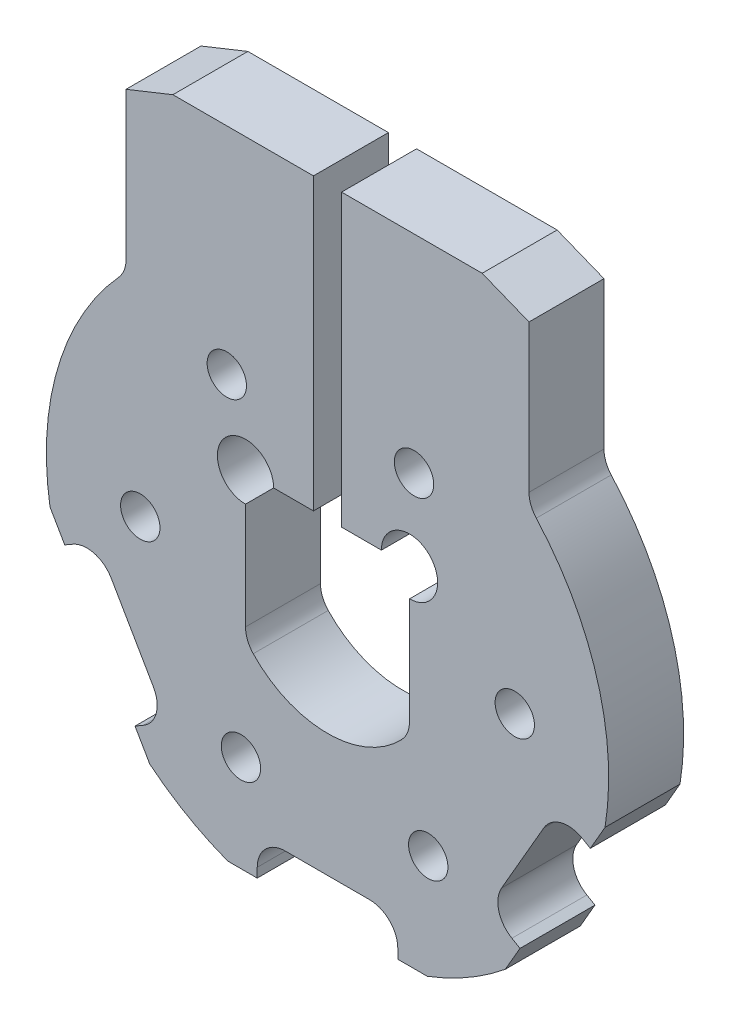
from build123d import *

# Parameters (mm, degrees)
SKIZZE1_R                       = 2.1
AUFSATZ_LINEAR_AUSTRAGEN1_DEPTH = 8


with BuildPart() as part:
    # Skizze1 → Aufsatz-Linear austragen1 (new body)
    with BuildSketch(Plane.XY):
        with BuildLine():
            Line((4.675877612, -29.316682076), (-4.324122388, -29.316682076))
            ThreePointArc((-4.324122388, -29.316682076), (-6.445442732, -30.195361732), (-7.324122388, -32.316682076))
            Line((-7.324122388, -32.316682076), (-7.324122388, -33.316682076))
            Line((-7.324122388, -33.316682076), (-10.470471537, -33.316682076))
            ThreePointArc((-10.470471537, -33.316682076), (-14.824122388, -31.250069093), (-18.790687157, -28.513003348))
            Line((-18.790687157, -28.513003348), (-20.363861732, -25.788185056))
            Line((-20.363861732, -25.788185056), (-19.497836328, -25.288185056))
            ThreePointArc((-19.497836328, -25.288185056), (-18.100058849, -23.46656598), (-18.399760116, -21.190108844))
            Line((-18.399760116, -21.190108844), (-22.899760116, -13.39588021))
            ThreePointArc((-22.899760116, -13.39588021), (-24.721379192, -11.998102732), (-26.997836328, -12.297803999))
            Line((-26.997836328, -12.297803999), (-27.863861732, -12.797803999))
            Line((-27.863861732, -12.797803999), (-29.437036306, -10.072985707))
            ThreePointArc((-29.437036306, -10.072985707), (-28.600016939, 3.212903394), (-22.096849661, 14.828593902))
            ThreePointArc((-22.096849661, 14.828593902), (-21.523960056, 15.761773146), (-21.324122388, 16.83838399))
            Line((-21.324122388, 16.83838399), (-21.324122388, 32.57630868))
            Line((-21.324122388, 32.57630868), (-16.324122388, 34.57630868))
            Line((-16.324122388, 34.57630868), (-1.324122388, 34.57630868))
            Line((-1.324122388, 34.57630868), (-1.324122388, 3.613832147))
            Line((-1.324122388, 3.613832147), (-5.574122388, 3.613832147))
            ThreePointArc((-5.574122388, 3.613832147), (-10.695442732, 5.735152491), (-8.574122388, 0.613832147))
            Line((-8.574122388, 0.613832147), (-8.574122388, -10.728641623))
            ThreePointArc((-8.574122388, -10.728641623), (-8.360409233, -11.840669331), (-7.749718641, -12.794260404))
            ThreePointArc((-7.749718641, -12.794260404), (0.175877612, -16.198167853), (8.101473864, -12.794260404))
            ThreePointArc((8.101473864, -12.794260404), (8.712164456, -11.840669331), (8.925877612, -10.728641623))
            Line((8.925877612, -10.728641623), (8.925877612, 0.613832147))
            ThreePointArc((8.925877612, 0.613832147), (11.047197955, 5.735152491), (5.925877612, 3.613832147))
            Line((5.925877612, 3.613832147), (1.675877612, 3.613832147))
            Line((1.675877612, 3.613832147), (1.675877612, 34.57630868))
            Line((1.675877612, 34.57630868), (16.675877612, 34.57630868))
            Line((16.675877612, 34.57630868), (21.675877612, 32.57630868))
            Line((21.675877612, 32.57630868), (21.675877612, 16.83838399))
            ThreePointArc((21.675877612, 16.83838399), (21.875715279, 15.761773146), (22.448604884, 14.828593902))
            ThreePointArc((22.448604884, 14.828593902), (28.951772162, 3.212903394), (29.788791529, -10.072985707))
            Line((29.788791529, -10.072985707), (28.215616955, -12.797803999))
            Line((28.215616955, -12.797803999), (27.349591551, -12.297803999))
            ThreePointArc((27.349591551, -12.297803999), (25.073134416, -11.998102732), (23.251515339, -13.39588021))
            Line((23.251515339, -13.39588021), (18.751515339, -21.190108844))
            ThreePointArc((18.751515339, -21.190108844), (18.451814072, -23.46656598), (19.849591551, -25.288185056))
            Line((19.849591551, -25.288185056), (20.715616955, -25.788185056))
            Line((20.715616955, -25.788185056), (19.14244238, -28.513003348))
            ThreePointArc((19.14244238, -28.513003348), (15.175877612, -31.250069093), (10.82222676, -33.316682076))
            Line((10.82222676, -33.316682076), (7.675877612, -33.316682076))
            Line((7.675877612, -33.316682076), (7.675877612, -32.316682076))
            ThreePointArc((7.675877612, -32.316682076), (6.797197955, -30.195361732), (4.675877612, -29.316682076))
        make_face()
        with Locations((9.410849876, 12.470909684)):
            Circle(SKIZZE1_R, mode=Mode.SUBTRACT)
        with Locations((20.156842043, -4.396919232)):
            Circle(SKIZZE1_R, mode=Mode.SUBTRACT)
        with Locations((10.921869778, -22.137135895)):
            Circle(SKIZZE1_R, mode=Mode.SUBTRACT)
        with Locations((-9.059094653, -23.009523643)):
            Circle(SKIZZE1_R, mode=Mode.SUBTRACT)
        with Locations((-10.570114555, 11.598521937)):
            Circle(SKIZZE1_R, mode=Mode.SUBTRACT)
        with Locations((-19.80508682, -6.141694726)):
            Circle(SKIZZE1_R, mode=Mode.SUBTRACT)
    extrude(amount=AUFSATZ_LINEAR_AUSTRAGEN1_DEPTH)


solid = part.part
